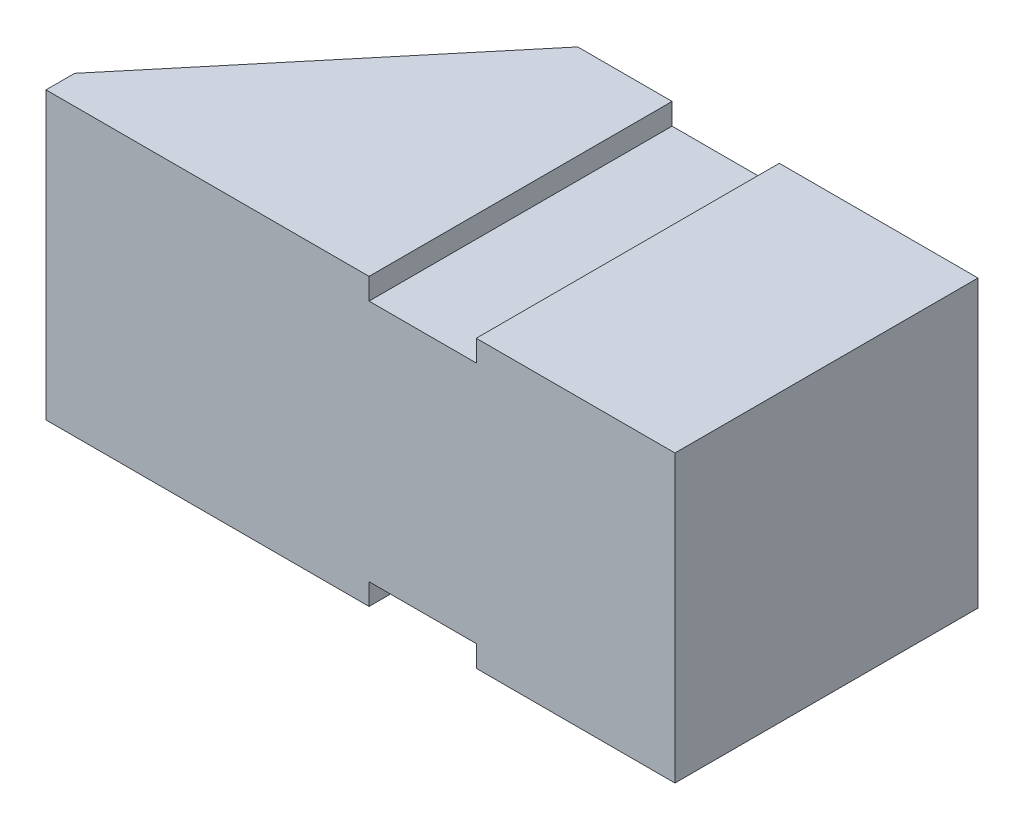
from build123d import *

# Parameters (mm, degrees)
SKETCH1_W               = 44
SKETCH1_H               = 20
BOSS_EXTRUDE1_DEPTH     = 21.2
CUT_EXTRUDE1_DEPTH      = 32.771685508
CUT_EXTRUDE1_DEPTH_BACK = 32.771685508
SKETCH4_W               = 17
SKETCH4_H               = 15
CUT_EXTRUDE3_DEPTH      = 0.7
CHAMFER3_SIZE           = 0.7
CHAMFER4_SIZE           = 0.7
SKETCH5_W               = 7.5
SKETCH5_H               = 1.5
CUT_EXTRUDE4_DEPTH      = 33.147161617


with BuildPart() as part:
    # Sketch1 → Boss-Extrude1 (new body)
    with BuildSketch(Plane.XY):
        Rectangle(SKETCH1_W, SKETCH1_H)
    extrude(amount=BOSS_EXTRUDE1_DEPTH)

    # Sketch2 → Cut-Extrude1 (cut, two sides: drawn at the far end of the back side and taken through both)
    with BuildSketch(Plane(origin=(0, -10, 11.2), x_dir=(1, 0, 0), z_dir=(0, 1, 0)).offset(-CUT_EXTRUDE1_DEPTH_BACK)):
        Polygon((-89.868081564, -89.441697876), (-22, -8), (-6, 11.2), (61.868081564, 92.641697876), (-101.015314189, 228.377861004), (-252.751477317, 46.294465251), align=None)
    extrude(amount=CUT_EXTRUDE1_DEPTH + CUT_EXTRUDE1_DEPTH_BACK, mode=Mode.SUBTRACT)

    # Sketch4 → Cut-Extrude3 (cut)
    with BuildSketch(Plane(origin=(-3.540983607, 0, -2.950819672), x_dir=(-0.6401843996644798, 0, 0.7682212795973761), z_dir=(-0.7682212795973761, 0, -0.6401843996644798))):
        with Locations((14.841106398, 0)):
            Rectangle(SKETCH4_W, SKETCH4_H)
    extrude(amount=-CUT_EXTRUDE3_DEPTH, mode=Mode.SUBTRACT)

    # Chamfer3
    chamfer3_edges = [part.edges().sort_by_distance(p)[0] for p in [
        (-13.042028396, 7.5, 8.450434076),
        (-13.042028396, -7.5, 8.450434076),
        (-7.600460999, 0, 1.920553199),
    ]]
    chamfer(chamfer3_edges, length=CHAMFER3_SIZE - 0.0001)  # a hair under: the kernel refuses the full size

    # Chamfer4
    chamfer4_edges = [part.edges().sort_by_distance(p)[0] for p in [
        (-17.945840898, 0, 15.428444032),
    ]]
    chamfer(chamfer4_edges, length=CHAMFER4_SIZE - 0.0001)  # a hair under: the kernel refuses the full size

    # Sketch5 → Cut-Extrude4 (cut, through all)
    with BuildSketch(Plane(origin=(0, 0, 0), x_dir=(-1, 0, 0), z_dir=(0, 0, -1))):
        with Locations((-4.35, 9.25)):
            Rectangle(SKETCH5_W, SKETCH5_H)
        with Locations((-4.35, -9.25)):
            Rectangle(SKETCH5_W, SKETCH5_H)
    extrude(amount=-CUT_EXTRUDE4_DEPTH, mode=Mode.SUBTRACT)


solid = part.part
